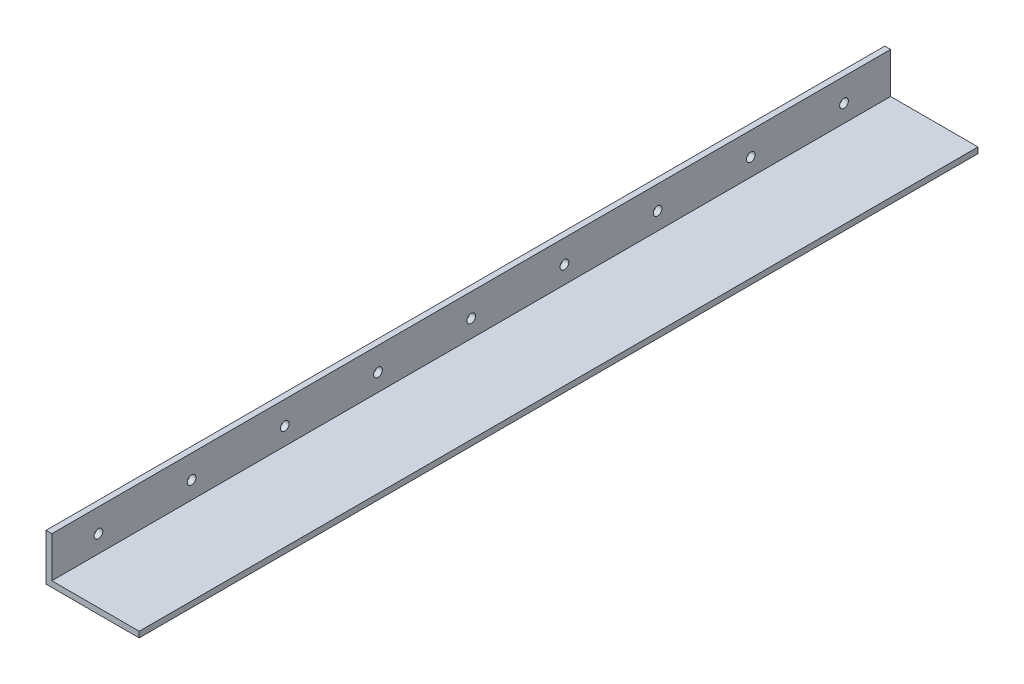
from build123d import *

# Parameters (mm, degrees)
BOSS_EXTRUDE1_DEPTH = 457.2
SKETCH2_R           = 2.38125
CUT_EXTRUDE1_DEPTH  = 461.714271539


with BuildPart() as part:
    # Sketch1 → Boss-Extrude1 (new body)
    with BuildSketch(Plane.XY):
        Polygon((0, 25.4), (0, 0), (50.8, 0), (50.8, 3.175), (3.175, 3.175), (3.175, 25.4), align=None)
    extrude(amount=BOSS_EXTRUDE1_DEPTH)

    # Sketch2 → Cut-Extrude1 (cut, through all)
    with BuildSketch(Plane.ZY):
        with Locations((431.8, 12.7)):
            Circle(SKETCH2_R)
        with Locations((381, 12.7)):
            Circle(SKETCH2_R)
        with Locations((330.2, 12.7)):
            Circle(SKETCH2_R)
        with Locations((279.4, 12.7)):
            Circle(SKETCH2_R)
        with Locations((228.6, 12.7)):
            Circle(SKETCH2_R)
        with Locations((177.8, 12.7)):
            Circle(SKETCH2_R)
        with Locations((127, 12.7)):
            Circle(SKETCH2_R)
        with Locations((76.2, 12.7)):
            Circle(SKETCH2_R)
        with Locations((25.4, 12.7)):
            Circle(SKETCH2_R)
        with Locations((-25.4, 12.7)):
            Circle(SKETCH2_R)
    extrude(amount=-CUT_EXTRUDE1_DEPTH, mode=Mode.SUBTRACT)


solid = part.part
